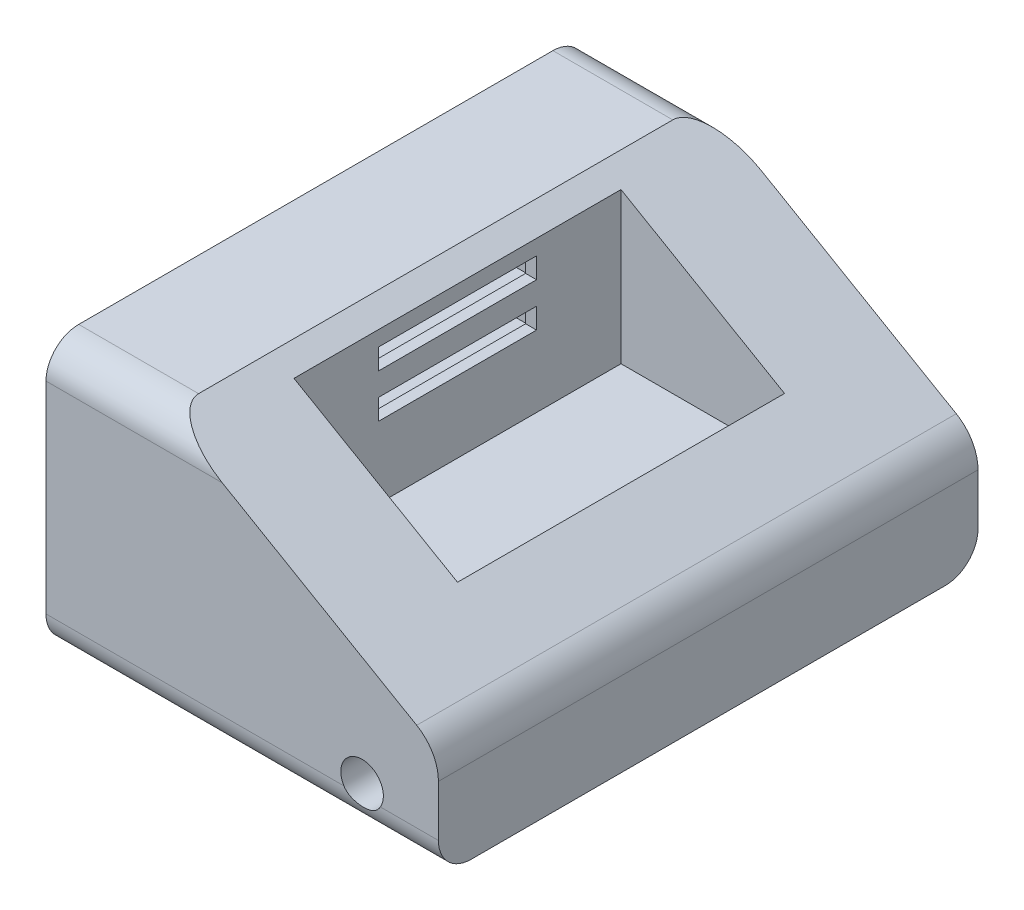
from build123d import *
from build123d.topology import SkipClean

# Parameters (mm, degrees)
SKETCH_1_W               = 49.5
SKETCH_1_H               = 24.5
EXTRUDE_1_DEPTH          = 36
SKETCH_2_R               = 2.5
CUT_EXTRUDE_1_DEPTH      = 3
SKETCH_3_W               = 15.2
SKETCH_3_H               = 2.5
CUT_EXTRUDE_2_DEPTH      = 12
FILLET_1_R               = 3
CUT_EXTRUDE_3_DEPTH      = 46.372072908
CUT_EXTRUDE_3_DEPTH_BACK = 46.372072908
SKETCH_5_R               = 1.95
CUT_EXTRUDE_4_DEPTH      = 63.42044953
CUT_EXTRUDE_4_DEPTH_BACK = 3
SKETCH_6_R               = 4
SKETCH_7_W               = 10
SKETCH_7_H               = 9
CUT_EXTRUDE_5_DEPTH      = 7.5
CUT_EXTRUDE_6_DEPTH      = 63.42044953
FILLET_2_R               = 4
SKETCH_9_W               = 15
SKETCH_9_H               = 30
CUT_EXTRUDE_7_DEPTH      = 15
SKETCH_11_W              = 14.5
SKETCH_11_H              = 1.9
CUT_EXTRUDE_8_DEPTH      = 2


with BuildPart() as part:
    # Эскиз1 → Бобышка-Вытянуть1 (new body)
    with BuildSketch(Plane(origin=(0, 0, 0), x_dir=(0, 0, -1), z_dir=(1, 0, 0))):
        Rectangle(SKETCH_1_W, SKETCH_1_H)
    extrude(amount=EXTRUDE_1_DEPTH)

    # Эскиз2 → Вырез-Вытянуть1 (cut)
    with BuildSketch(Plane.ZY):
        with Locations((-20, -7.25)):
            Circle(SKETCH_2_R)
        with Locations((20, -7.25)):
            Circle(SKETCH_2_R)
    extrude(amount=-CUT_EXTRUDE_1_DEPTH, mode=Mode.SUBTRACT)

    # Эскиз3 → Вырез-Вытянуть2 (cut)
    with BuildSketch(Plane.ZY):
        with Locations((0, 4.75)):
            Rectangle(SKETCH_3_W, SKETCH_3_H)
        with Locations((0, 8.75)):
            Rectangle(SKETCH_3_W, SKETCH_3_H)
    extrude(amount=-CUT_EXTRUDE_2_DEPTH, mode=Mode.SUBTRACT)

    # Скругление1
    fillet_1_edges = [part.edges().sort_by_distance(p)[0] for p in [
        (18, 12.25, -24.75),
        (18, -12.25, -24.75),
        (18, 12.25, 24.75),
        (18, -12.25, 24.75),
    ]]
    fillet(fillet_1_edges, radius=FILLET_1_R)

    # Эскиз5 → Вырез-Вытянуть3 (cut, two sides: drawn at the far end of the back side and taken through both)
    with BuildSketch(Plane.XY.offset(-CUT_EXTRUDE_3_DEPTH_BACK)):
        with Locations((29, -8.25)):
            Circle(SKETCH_5_R)
    extrude(amount=CUT_EXTRUDE_3_DEPTH + CUT_EXTRUDE_3_DEPTH_BACK, mode=Mode.SUBTRACT)

    # Эскиз6 → Вырез-Вытянуть4 (cut, two sides: drawn at the far end of the back side and taken through both)
    with BuildSketch(Plane(origin=(0, 0, -24.75), x_dir=(-1, 0, 0), z_dir=(0, 0, -1)).offset(-CUT_EXTRUDE_4_DEPTH_BACK)):
        with Locations((-29, -8.25)):
            Circle(SKETCH_6_R)
    extrude(amount=CUT_EXTRUDE_4_DEPTH + CUT_EXTRUDE_4_DEPTH_BACK, mode=Mode.SUBTRACT)

    # Эскиз7 → Вырез-Вытянуть5 (cut, symmetric)
    with SkipClean():  # the faces are left unmerged after this step: merging them gives an invalid solid
        with BuildSketch(Plane.XY):
            with Locations((29, -7.75)):
                Rectangle(SKETCH_7_W, SKETCH_7_H)
        extrude(amount=CUT_EXTRUDE_5_DEPTH, both=True, mode=Mode.SUBTRACT)

    # Эскиз8 → Вырез-Вытянуть6 (cut, through all)
    with SkipClean():  # the faces are left unmerged after this step: merging them gives an invalid solid
        with BuildSketch(Plane(origin=(0, 0, -24.75), x_dir=(-1, 0, 0), z_dir=(0, 0, -1))):
            Polygon((-11, 12.25), (-36, -2.25), (-36, 12.25), align=None)
        extrude(amount=-CUT_EXTRUDE_6_DEPTH, mode=Mode.SUBTRACT)

    # Скругление2
    fillet_2_edges = [part.edges().sort_by_distance(p)[0] for p in [
        (36, -2.25, 0),
    ]]
    fillet(fillet_2_edges, radius=FILLET_2_R)

    # Эскиз9 → Вырез-Вытянуть7 (cut)
    with BuildSketch(Plane.XZ.offset(-12.25)):
        with Locations((20.5, 0)):
            Rectangle(SKETCH_9_W, SKETCH_9_H)
    extrude(amount=CUT_EXTRUDE_7_DEPTH, mode=Mode.SUBTRACT)

    # Эскиз11 → Вырез-Вытянуть8 (cut)
    with BuildSketch(Plane.ZY.offset(-12)):
        with Locations((0, 8.75)):
            Rectangle(SKETCH_11_W, SKETCH_11_H)
        with Locations((0, 4.75)):
            Rectangle(SKETCH_11_W, SKETCH_11_H)
    extrude(amount=-CUT_EXTRUDE_8_DEPTH, mode=Mode.SUBTRACT)


solid = part.part
